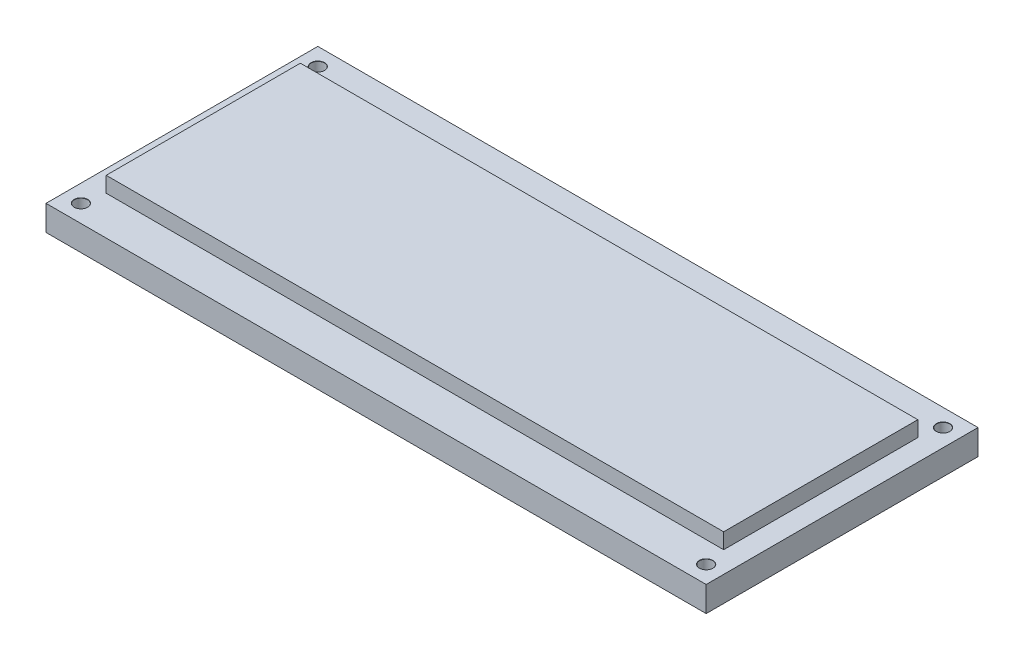
from build123d import *

# Parameters (mm, degrees)
SKETCH1_W                      = 170
SKETCH1_H                      = 70
BOSS_EXTRUDE1_DEPTH            = 6.5
SKETCH2_W                      = 159
SKETCH2_H                      = 50
BOSS_EXTRUDE2_DEPTH            = 4
M3_CLEARANCE_HOLE1_D           = 3.4
M3_CLEARANCE_HOLE1_CSINK_D     = 3.5
M3_CLEARANCE_HOLE1_CSINK_ANGLE = 90


with BuildPart() as part:
    # Sketch1 → Boss-Extrude1 (new body)
    with BuildSketch(Plane(origin=(0, 0, 0), x_dir=(1, 0, 0), z_dir=(0, 1, 0))):
        Rectangle(SKETCH1_W, SKETCH1_H)
    extrude(amount=BOSS_EXTRUDE1_DEPTH)

    # Sketch2 → Boss-Extrude2 (add)
    with BuildSketch(Plane(origin=(0, 6.5, 0), x_dir=(1, 0, 0), z_dir=(0, 1, 0))):
        Rectangle(SKETCH2_W, SKETCH2_H)
    extrude(amount=BOSS_EXTRUDE2_DEPTH)

    # M3 Clearance Hole1 (through all)
    with Locations(Plane(origin=(0, 6.5, 0), x_dir=(1, 0, 0), z_dir=(0, 1, 0))):
        with Locations((80.5, -30.5), (80.5, 30.5), (-80.5, -30.5), (-80.5, 30.5)):
            CounterSinkHole(M3_CLEARANCE_HOLE1_D / 2, M3_CLEARANCE_HOLE1_CSINK_D / 2, counter_sink_angle=M3_CLEARANCE_HOLE1_CSINK_ANGLE)


solid = part.part
